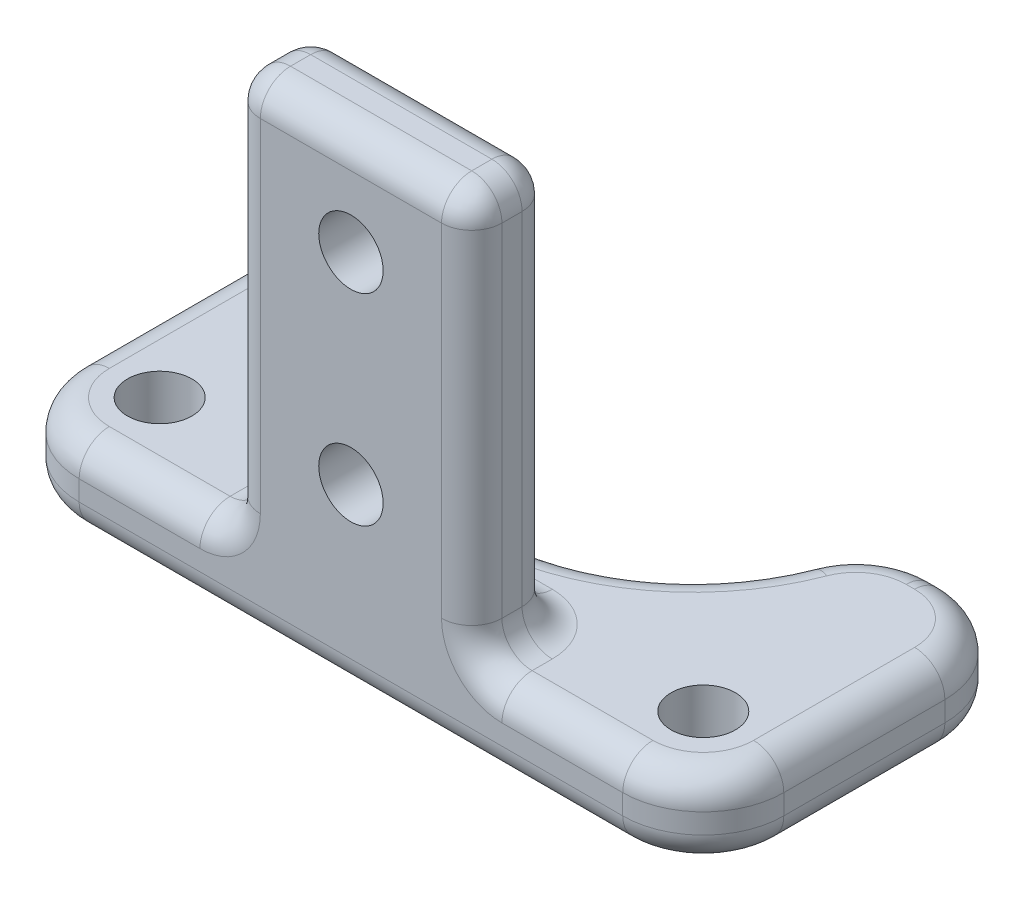
from build123d import *

# Parameters (mm, degrees)
BOSS_EXTRUDE1_DEPTH          = 4
SKETCH7_W                    = 12
SKETCH7_H                    = 4
BOSS_EXTRUDE2_DEPTH          = 20
M3_CLEARANCE_HOLE1_OUTLINE_R = 1.6
M3_CLEARANCE_HOLE1_DEPTH     = 4
FILLET1_R                    = 4
M3_START                     = -4
M3_CLEARANCE_HOLE2_OUTLINE_R = 1.6
M3_CLEARANCE_HOLE2_DEPTH     = 4
FILLET2_R                    = 1.5


# Read off the part's stored shape, not the designer's step: M3 Clearance Hole1, M3 Clearance Hole2
with BuildPart() as part:
    # Sketch2 → Boss-Extrude1 (new body)
    with BuildSketch(Plane(origin=(0, 0, 0), x_dir=(1, 0, 0), z_dir=(0, 1, 0))):
        with BuildLine():
            Line((-0.449874371, 16), (-8, 16))
            Line((-8, 16), (-8, 0))
            Line((-8, 0), (27, 0))
            Line((27, 0), (27, 16))
            Line((27, 16), (19.449874371, 16))
            ThreePointArc((19.449874371, 16), (9.5, 7), (-0.449874371, 16))
        make_face()
    extrude(amount=BOSS_EXTRUDE1_DEPTH)

    # Sketch7 → Boss-Extrude2 (add)
    with BuildSketch(Plane(origin=(0, 4, 0), x_dir=(1, 0, 0), z_dir=(0, 1, 0))):
        with Locations((9.5, 2)):
            Rectangle(SKETCH7_W, SKETCH7_H)
    extrude(amount=BOSS_EXTRUDE2_DEPTH)

    # M3 Clearance Hole1 outline → M3 Clearance Hole1 (cut)
    with BuildSketch(Plane(origin=(0, 0, 0), x_dir=(1, 0, 0), z_dir=(0, 1, 0))):
        with Locations((23, 4)):
            Circle(M3_CLEARANCE_HOLE1_OUTLINE_R)
        with Locations((-4, 4)):
            Circle(M3_CLEARANCE_HOLE1_OUTLINE_R)
    extrude(amount=M3_CLEARANCE_HOLE1_DEPTH, mode=Mode.SUBTRACT)

    # Fillet1
    fillet1_edges = [part.edges().sort_by_distance(p)[0] for p in [
        (27, 2, -16),
        (27, 2, 0),
        (-8, 2, 0),
        (-8, 2, -16),
        (-0.449874371, 2, -16),
        (19.449874371, 2, -16),
    ]]
    fillet(fillet1_edges, radius=FILLET1_R)

    # M3 Clearance Hole2 outline → M3 Clearance Hole2 (cut)
    with BuildSketch(Plane.XY.offset(M3_START)):
        with Locations((9.5, 9)):
            Circle(M3_CLEARANCE_HOLE2_OUTLINE_R)
        with Locations((9.5, 19)):
            Circle(M3_CLEARANCE_HOLE2_OUTLINE_R)
    extrude(amount=M3_CLEARANCE_HOLE2_DEPTH, mode=Mode.SUBTRACT)

    # Fillet2
    # the kernel refuses this fillet: 1.5 mm, written as the material it takes off along each edge
    with BuildSketch(Plane(origin=(5, 22.5, -2.5), x_dir=(0, 0, -1), z_dir=(-1, 0, 0))) as fillet2_piece_1_section:
        Polygon((0, 0), (FILLET2_R, 0), (FILLET2_R, -FILLET2_R), (0, -FILLET2_R), align=None)
    fillet2_piece_1 = extrude(amount=FILLET2_R, mode=Mode.PRIVATE)
    fillet2_piece_1 = fillet2_piece_1 - Plane(origin=(5, 22.5, -2.5), x_dir=(0, -0.7071067811865475, 0.7071067811865475), z_dir=(-1, 0, 0)) * Sphere(FILLET2_R, mode=Mode.PRIVATE)
    add(fillet2_piece_1, mode=Mode.SUBTRACT)
    with BuildSketch(Plane(origin=(14, 22.5, -2.5), x_dir=(0, 0, -1), z_dir=(1, 0, 0))) as fillet2_piece_2_section:
        Polygon((0, 0), (FILLET2_R, 0), (FILLET2_R, FILLET2_R), (0, FILLET2_R), align=None)
    fillet2_piece_2 = extrude(amount=FILLET2_R, mode=Mode.PRIVATE)
    fillet2_piece_2 = fillet2_piece_2 - Plane(origin=(14, 22.5, -2.5), x_dir=(0, -0.7071067811865475, 0.7071067811865475), z_dir=(1, 0, 0)) * Sphere(FILLET2_R, mode=Mode.PRIVATE)
    add(fillet2_piece_2, mode=Mode.SUBTRACT)
    with BuildSketch(Plane(origin=(3.5, 4, -4), x_dir=(0, 0, 1), z_dir=(0, 1, 0))) as fillet2_piece_3:
        with BuildLine():
            CenterArc((FILLET2_R, FILLET2_R), FILLET2_R, 180, 90)
            Line((0, FILLET2_R), (0, 0))
            Line((0, 0), (FILLET2_R, 0))
        make_face()
    extrude(amount=18.5, mode=Mode.SUBTRACT)
    with BuildSketch(Plane(origin=(15.5, 4, -4), x_dir=(0, 0, 1), z_dir=(0, 1, 0))) as fillet2_piece_4:
        with BuildLine():
            CenterArc((FILLET2_R, -FILLET2_R), FILLET2_R, 90, 90)
            Line((0, -FILLET2_R), (0, 0))
            Line((0, 0), (FILLET2_R, 0))
        make_face()
    extrude(amount=18.5, mode=Mode.SUBTRACT)
    with BuildSketch(Plane(origin=(3.5, 24, 3.75), x_dir=(0, -1, 0), z_dir=(0, 0, -1)), Plane(origin=(15.5, 24, -2.5), x_dir=(0, -1, 0), z_dir=(0, 0, 1))) as fillet2_piece_5:
        with BuildLine():
            CenterArc((FILLET2_R, -FILLET2_R), FILLET2_R, 90, 90)
            Line((0, -FILLET2_R), (0, 0))
            Line((0, 0), (FILLET2_R, 0))
        make_face()
    extrude(amount=6.25, mode=Mode.SUBTRACT)
    with BuildSketch(Plane(origin=(19.25, 24, 0), x_dir=(0, -1, 0), z_dir=(-1, 0, 0))) as fillet2_piece_6:
        with BuildLine():
            CenterArc((FILLET2_R, -FILLET2_R), FILLET2_R, 90, 90)
            Line((0, -FILLET2_R), (0, 0))
            Line((0, 0), (FILLET2_R, 0))
        make_face()
    extrude(amount=19.5, mode=Mode.SUBTRACT)
    with BuildSketch(Plane(origin=(5, 24, -4), x_dir=(0, -1, 0), z_dir=(1, 0, 0))) as fillet2_piece_7:
        with BuildLine():
            CenterArc((FILLET2_R, -FILLET2_R), FILLET2_R, 90, 90)
            Line((0, -FILLET2_R), (0, 0))
            Line((0, 0), (FILLET2_R, 0))
        make_face()
    extrude(amount=9, mode=Mode.SUBTRACT)
    with BuildSketch(Plane(origin=(23, 0, -4), x_dir=(1, 0, 0), z_dir=(0, 0, 1))) as fillet2_piece_8:
        with BuildLine():
            CenterArc((1.6 + FILLET2_R, FILLET2_R), FILLET2_R, 180, 90)
            Line((1.6, FILLET2_R), (1.6, 0))
            Line((1.6, 0), (1.6 + FILLET2_R, 0))
        make_face()
    revolve(axis=Axis((23, 0, -4), (0, 1, 0)), mode=Mode.SUBTRACT)
    with BuildSketch(Plane(origin=(-4, 0, -4), x_dir=(1, 0, 0), z_dir=(0, 0, 1))) as fillet2_piece_9:
        with BuildLine():
            CenterArc((1.6 + FILLET2_R, FILLET2_R), FILLET2_R, 180, 90)
            Line((1.6, FILLET2_R), (1.6, 0))
            Line((1.6, 0), (1.6 + FILLET2_R, 0))
        make_face()
    revolve(axis=Axis((-4, 0, -4), (0, 1, 0)), mode=Mode.SUBTRACT)
    with BuildSketch(Plane(origin=(9.5, 0, -17), x_dir=(0.9340497736158586, 0, 0.3571428571428573), z_dir=(0.3571428571428573, 0, -0.9340497736158586))) as fillet2_piece_10:
        with BuildLine():
            CenterArc((10 + FILLET2_R, -FILLET2_R), FILLET2_R, 90, 90)
            Line((10, -FILLET2_R), (10, 0))
            Line((10, 0), (10 + FILLET2_R, 0))
        make_face()
    revolve(axis=Axis((9.5, 0, -17), (0, -1, 0)), revolution_arc=138.150335145, mode=Mode.SUBTRACT)
    with BuildSketch(Plane(origin=(23, 0, -16), x_dir=(0, 0, 1), z_dir=(-1, 0, 0))) as fillet2_piece_11:
        with BuildLine():
            CenterArc((FILLET2_R, FILLET2_R), FILLET2_R, 180, 90)
            Line((0, FILLET2_R), (0, 0))
            Line((0, 0), (FILLET2_R, 0))
        make_face()
    extrude(amount=0.423303169, mode=Mode.SUBTRACT)
    with BuildSketch(Plane(origin=(27, 0, -4), x_dir=(-1, 0, 0), z_dir=(0, 0, -1)), Plane(origin=(-8, 0, -12), x_dir=(1, 0, 0), z_dir=(0, 0, 1))) as fillet2_piece_12:
        with BuildLine():
            CenterArc((FILLET2_R, FILLET2_R), FILLET2_R, 180, 90)
            Line((0, FILLET2_R), (0, 0))
            Line((0, 0), (FILLET2_R, 0))
        make_face()
    extrude(amount=8, mode=Mode.SUBTRACT)
    with BuildSketch(Plane(origin=(-4, 0, 0), x_dir=(0, 0, -1), z_dir=(1, 0, 0))) as fillet2_piece_13:
        with BuildLine():
            CenterArc((FILLET2_R, FILLET2_R), FILLET2_R, 180, 90)
            Line((0, FILLET2_R), (0, 0))
            Line((0, 0), (FILLET2_R, 0))
        make_face()
    extrude(amount=27, mode=Mode.SUBTRACT)
    with BuildSketch(Plane(origin=(-3.576696831, 0, -16), x_dir=(0, 1, 0), z_dir=(-1, 0, 0))) as fillet2_piece_14:
        with BuildLine():
            CenterArc((FILLET2_R, -FILLET2_R), FILLET2_R, 90, 90)
            Line((0, -FILLET2_R), (0, 0))
            Line((0, 0), (FILLET2_R, 0))
        make_face()
    extrude(amount=0.423303169, mode=Mode.SUBTRACT)
    with BuildSketch(Plane(origin=(-4, 0, -12), x_dir=(0, 0, -1), z_dir=(1, 0, 0))) as fillet2_piece_15:
        with BuildLine():
            CenterArc((4 - FILLET2_R, FILLET2_R), FILLET2_R, 270, 90)
            Line((4, FILLET2_R), (4, 0))
            Line((4, 0), (4 - FILLET2_R, 0))
        make_face()
    revolve(axis=Axis((-4, 0, -12), (0, 1, 0)), revolution_arc=90, mode=Mode.SUBTRACT)
    with BuildSketch(Plane(origin=(-4, 0, -4), x_dir=(-1, 0, 0), z_dir=(0, 0, -1))) as fillet2_piece_16:
        with BuildLine():
            CenterArc((4 - FILLET2_R, FILLET2_R), FILLET2_R, 270, 90)
            Line((4, FILLET2_R), (4, 0))
            Line((4, 0), (4 - FILLET2_R, 0))
        make_face()
    revolve(axis=Axis((-4, 0, -4), (0, 1, 0)), revolution_arc=90, mode=Mode.SUBTRACT)
    with BuildSketch(Plane(origin=(23, 0, -4), x_dir=(0, 0, 1), z_dir=(-1, 0, 0))) as fillet2_piece_17:
        with BuildLine():
            CenterArc((4 - FILLET2_R, FILLET2_R), FILLET2_R, 270, 90)
            Line((4, FILLET2_R), (4, 0))
            Line((4, 0), (4 - FILLET2_R, 0))
        make_face()
    revolve(axis=Axis((23, 0, -4), (0, 1, 0)), revolution_arc=90, mode=Mode.SUBTRACT)
    with BuildSketch(Plane(origin=(23, 0, -12), x_dir=(0, 0, -1), z_dir=(-1, 0, 0))) as fillet2_piece_18:
        with BuildLine():
            CenterArc((4 - FILLET2_R, -FILLET2_R), FILLET2_R, 0, 90)
            Line((4, -FILLET2_R), (4, 0))
            Line((4, 0), (4 - FILLET2_R, 0))
        make_face()
    revolve(axis=Axis((23, 0, -12), (0, -1, 0)), revolution_arc=90, mode=Mode.SUBTRACT)
    with BuildSketch(Plane(origin=(-3.576696831, 0, -12), x_dir=(0, 0, -1), z_dir=(-1, 0, 0))) as fillet2_piece_19:
        with BuildLine():
            CenterArc((4 - FILLET2_R, -FILLET2_R), FILLET2_R, 0, 90)
            Line((4, -FILLET2_R), (4, 0))
            Line((4, 0), (4 - FILLET2_R, 0))
        make_face()
    revolve(axis=Axis((-3.576696831, 0, -12), (0, -1, 0)), revolution_arc=69.075167572, mode=Mode.SUBTRACT)
    with BuildSketch(Plane(origin=(22.576696831, 0, -12), x_dir=(-0.9340497736158588, 0, -0.3571428571428566), z_dir=(-0.3571428571428566, 0, 0.9340497736158588))) as fillet2_piece_20:
        with BuildLine():
            CenterArc((4 - FILLET2_R, -FILLET2_R), FILLET2_R, 0, 90)
            Line((4, -FILLET2_R), (4, 0))
            Line((4, 0), (4 - FILLET2_R, 0))
        make_face()
    revolve(axis=Axis((22.576696831, 0, -12), (0, -1, 0)), revolution_arc=69.075167572, mode=Mode.SUBTRACT)
    # the kernel refuses this fillet: 1.5 mm, written as the material it adds along each edge
    with BuildSketch(Plane(origin=(3.5, 4, 0), x_dir=(-1, 0, 0), z_dir=(0, 0, -1)), Plane(origin=(15.5, 4, -2.5), x_dir=(1, 0, 0), z_dir=(0, 0, 1))) as fillet2_2_piece_1:
        with BuildLine():
            CenterArc((FILLET2_R, FILLET2_R), FILLET2_R, 180, 90)
            Line((0, FILLET2_R), (0, 0))
            Line((0, 0), (FILLET2_R, 0))
        make_face()
    extrude(amount=2.5)
    with BuildSketch(Plane(origin=(5, 4, -4), x_dir=(0, 0, -1), z_dir=(1, 0, 0))) as fillet2_2_piece_2:
        with BuildLine():
            CenterArc((FILLET2_R, FILLET2_R), FILLET2_R, 180, 90)
            Line((0, FILLET2_R), (0, 0))
            Line((0, 0), (FILLET2_R, 0))
        make_face()
    extrude(amount=9)
    with BuildSketch(Plane(origin=(5, 4, -2.5), x_dir=(-1, 0, 0), z_dir=(0, 0, 1))) as fillet2_2_piece_3:
        with BuildLine():
            CenterArc((1.5 + FILLET2_R, -FILLET2_R), FILLET2_R, 90, 90)
            Line((1.5, -FILLET2_R), (1.5, 0))
            Line((1.5, 0), (1.5 + FILLET2_R, 0))
        make_face()
    revolve(axis=Axis((5, 4, -2.5), (0, -1, 0)), revolution_arc=90)
    with BuildSketch(Plane(origin=(14, 4, -2.5), x_dir=(1, 0, 0), z_dir=(0, 0, 1))) as fillet2_2_piece_4:
        with BuildLine():
            CenterArc((1.5 + FILLET2_R, FILLET2_R), FILLET2_R, 180, 90)
            Line((1.5, FILLET2_R), (1.5, 0))
            Line((1.5, 0), (1.5 + FILLET2_R, 0))
        make_face()
    revolve(axis=Axis((14, 4, -2.5), (0, 1, 0)), revolution_arc=90)
    # the kernel refuses this fillet: 1.5 mm, written as the material it takes off along each edge
    with BuildSketch(Plane(origin=(14, 22.5, -1.5), x_dir=(1, 0, 0), z_dir=(0, 0, 1))) as fillet2_3_piece_1_section:
        Polygon((0, 0), (FILLET2_R, 0), (FILLET2_R, FILLET2_R), (0, FILLET2_R), align=None)
    fillet2_3_piece_1 = extrude(amount=FILLET2_R, mode=Mode.PRIVATE)
    fillet2_3_piece_1 = fillet2_3_piece_1 - Plane(origin=(14, 22.5, -1.5), x_dir=(-0.7071067811865475, -0.7071067811865475, 0), z_dir=(0, 0, 1)) * Sphere(FILLET2_R, mode=Mode.PRIVATE)
    add(fillet2_3_piece_1, mode=Mode.SUBTRACT)
    with BuildSketch(Plane(origin=(5, 22.5, -1.5), x_dir=(-1, 0, 0), z_dir=(0, 0, 1))) as fillet2_3_piece_2_section:
        Polygon((0, 0), (FILLET2_R, 0), (FILLET2_R, -FILLET2_R), (0, -FILLET2_R), align=None)
    fillet2_3_piece_2 = extrude(amount=FILLET2_R, mode=Mode.PRIVATE)
    fillet2_3_piece_2 = fillet2_3_piece_2 - Plane(origin=(5, 22.5, -1.5), x_dir=(0.7071067811865475, -0.7071067811865475, 0), z_dir=(0, 0, 1)) * Sphere(FILLET2_R, mode=Mode.PRIVATE)
    add(fillet2_3_piece_2, mode=Mode.SUBTRACT)
    with BuildSketch(Plane(origin=(-4, 4, 0), x_dir=(0, 0, -1), z_dir=(1, 0, 0)), Plane(origin=(17, 4, 0), x_dir=(0, 0, -1), z_dir=(1, 0, 0))) as fillet2_3_piece_3:
        with BuildLine():
            CenterArc((FILLET2_R, -FILLET2_R), FILLET2_R, 90, 90)
            Line((0, -FILLET2_R), (0, 0))
            Line((0, 0), (FILLET2_R, 0))
        make_face()
    extrude(amount=6, mode=Mode.SUBTRACT)
    with BuildSketch(Plane(origin=(3.5, 5.5, 0), x_dir=(1, 0, 0), z_dir=(0, 1, 0))) as fillet2_3_piece_4:
        with BuildLine():
            CenterArc((FILLET2_R, FILLET2_R), FILLET2_R, 180, 90)
            Line((0, FILLET2_R), (0, 0))
            Line((0, 0), (FILLET2_R, 0))
        make_face()
    extrude(amount=17, mode=Mode.SUBTRACT)
    with BuildSketch(Plane(origin=(15.5, 5.5, 0), x_dir=(-1, 0, 0), z_dir=(0, 1, 0))) as fillet2_3_piece_5:
        with BuildLine():
            CenterArc((FILLET2_R, -FILLET2_R), FILLET2_R, 90, 90)
            Line((0, -FILLET2_R), (0, 0))
            Line((0, 0), (FILLET2_R, 0))
        make_face()
    extrude(amount=17, mode=Mode.SUBTRACT)
    with BuildSketch(Plane(origin=(9.5, 4, -17), x_dir=(0.9340497736158586, 0, 0.3571428571428573), z_dir=(0.3571428571428573, 0, -0.9340497736158586))) as fillet2_3_piece_6:
        with BuildLine():
            CenterArc((10 + FILLET2_R, FILLET2_R), FILLET2_R, 180, 90)
            Line((10, FILLET2_R), (10, 0))
            Line((10, 0), (10 + FILLET2_R, 0))
        make_face()
    revolve(axis=Axis((9.5, 4, -17), (0, -1, 0)), revolution_arc=138.150335145, mode=Mode.SUBTRACT)
    with BuildSketch(Plane(origin=(23, 4, -16), x_dir=(0, 0, 1), z_dir=(-1, 0, 0))) as fillet2_3_piece_7:
        with BuildLine():
            CenterArc((FILLET2_R, -FILLET2_R), FILLET2_R, 90, 90)
            Line((0, -FILLET2_R), (0, 0))
            Line((0, 0), (FILLET2_R, 0))
        make_face()
    extrude(amount=0.423303169, mode=Mode.SUBTRACT)
    with BuildSketch(Plane(origin=(27, 4, -4), x_dir=(-1, 0, 0), z_dir=(0, 0, -1)), Plane(origin=(-8, 4, -12), x_dir=(1, 0, 0), z_dir=(0, 0, 1))) as fillet2_3_piece_8:
        with BuildLine():
            CenterArc((FILLET2_R, -FILLET2_R), FILLET2_R, 90, 90)
            Line((0, -FILLET2_R), (0, 0))
            Line((0, 0), (FILLET2_R, 0))
        make_face()
    extrude(amount=8, mode=Mode.SUBTRACT)
    with BuildSketch(Plane(origin=(-3.576696831, 4, -16), x_dir=(0, -1, 0), z_dir=(-1, 0, 0))) as fillet2_3_piece_9:
        with BuildLine():
            CenterArc((FILLET2_R, FILLET2_R), FILLET2_R, 180, 90)
            Line((0, FILLET2_R), (0, 0))
            Line((0, 0), (FILLET2_R, 0))
        make_face()
    extrude(amount=0.423303169, mode=Mode.SUBTRACT)
    with BuildSketch(Plane(origin=(-4, 4, -12), x_dir=(0, 0, -1), z_dir=(1, 0, 0))) as fillet2_3_piece_10:
        with BuildLine():
            CenterArc((4 - FILLET2_R, -FILLET2_R), FILLET2_R, 0, 90)
            Line((4 - FILLET2_R, 0), (4, 0))
            Line((4, 0), (4, -FILLET2_R))
        make_face()
    revolve(axis=Axis((-4, 4, -12), (0, 1, 0)), revolution_arc=90, mode=Mode.SUBTRACT)
    with BuildSketch(Plane(origin=(-4, 4, -4), x_dir=(-1, 0, 0), z_dir=(0, 0, -1))) as fillet2_3_piece_11:
        with BuildLine():
            CenterArc((4 - FILLET2_R, -FILLET2_R), FILLET2_R, 0, 90)
            Line((4, -FILLET2_R), (4, 0))
            Line((4, 0), (4 - FILLET2_R, 0))
        make_face()
    revolve(axis=Axis((-4, 4, -4), (0, 1, 0)), revolution_arc=90, mode=Mode.SUBTRACT)
    with BuildSketch(Plane(origin=(23, 4, -4), x_dir=(0, 0, 1), z_dir=(-1, 0, 0))) as fillet2_3_piece_12:
        with BuildLine():
            CenterArc((4 - FILLET2_R, -FILLET2_R), FILLET2_R, 0, 90)
            Line((4, -FILLET2_R), (4, 0))
            Line((4, 0), (4 - FILLET2_R, 0))
        make_face()
    revolve(axis=Axis((23, 4, -4), (0, 1, 0)), revolution_arc=90, mode=Mode.SUBTRACT)
    with BuildSketch(Plane(origin=(23, 4, -12), x_dir=(0, 0, -1), z_dir=(-1, 0, 0))) as fillet2_3_piece_13:
        with BuildLine():
            CenterArc((4 - FILLET2_R, FILLET2_R), FILLET2_R, 270, 90)
            Line((4, FILLET2_R), (4, 0))
            Line((4, 0), (4 - FILLET2_R, 0))
        make_face()
    revolve(axis=Axis((23, 4, -12), (0, -1, 0)), revolution_arc=90, mode=Mode.SUBTRACT)
    with BuildSketch(Plane(origin=(-3.576696831, 4, -12), x_dir=(0, 0, -1), z_dir=(-1, 0, 0))) as fillet2_3_piece_14:
        with BuildLine():
            CenterArc((4 - FILLET2_R, FILLET2_R), FILLET2_R, 270, 90)
            Line((4, FILLET2_R), (4, 0))
            Line((4, 0), (4 - FILLET2_R, 0))
        make_face()
    revolve(axis=Axis((-3.576696831, 4, -12), (0, -1, 0)), revolution_arc=69.075167572, mode=Mode.SUBTRACT)
    with BuildSketch(Plane(origin=(22.576696831, 4, -12), x_dir=(-0.9340497736158588, 0, -0.3571428571428566), z_dir=(-0.3571428571428566, 0, 0.9340497736158588))) as fillet2_3_piece_15:
        with BuildLine():
            CenterArc((4 - FILLET2_R, FILLET2_R), FILLET2_R, 270, 90)
            Line((4, FILLET2_R), (4, 0))
            Line((4, 0), (4 - FILLET2_R, 0))
        make_face()
    revolve(axis=Axis((22.576696831, 4, -12), (0, -1, 0)), revolution_arc=69.075167572, mode=Mode.SUBTRACT)
    with BuildSketch(Plane(origin=(17, 5.5, 0), x_dir=(0, -1, 0), z_dir=(1, 0, 0))) as fillet2_3_piece_16:
        with BuildLine():
            CenterArc((1.5 + FILLET2_R, FILLET2_R), FILLET2_R, 180, 90)
            Line((1.5, FILLET2_R), (1.5, 0))
            Line((1.5, 0), (1.5 + FILLET2_R, 0))
        make_face()
    revolve(axis=Axis((17, 5.5, 0), (0, 0, -1)), revolution_arc=90, mode=Mode.SUBTRACT)
    with BuildSketch(Plane(origin=(2, 5.5, 0), x_dir=(0, -1, 0), z_dir=(-1, 0, 0))) as fillet2_3_piece_17:
        with BuildLine():
            CenterArc((1.5 + FILLET2_R, -FILLET2_R), FILLET2_R, 90, 90)
            Line((1.5, -FILLET2_R), (1.5, 0))
            Line((1.5, 0), (1.5 + FILLET2_R, 0))
        make_face()
    revolve(axis=Axis((2, 5.5, 0), (0, 0, 1)), revolution_arc=90, mode=Mode.SUBTRACT)


solid = part.part
